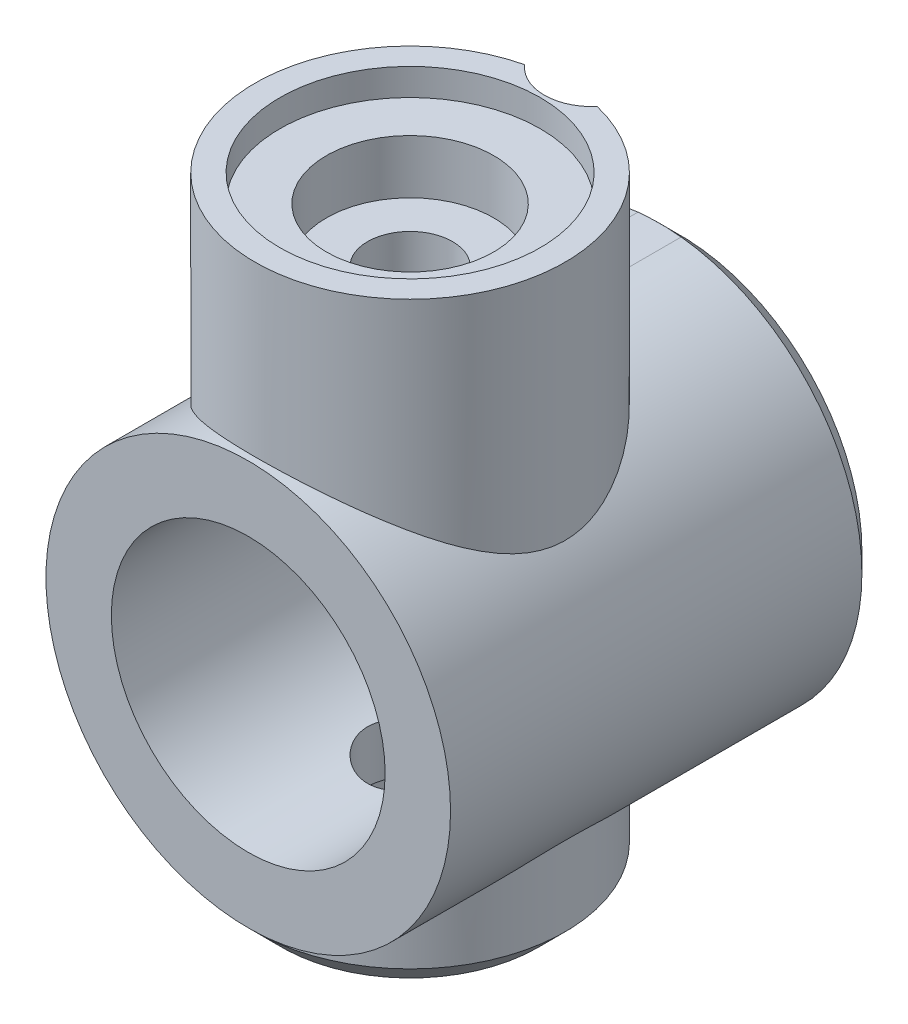
from build123d import *

# Parameters (mm, degrees)
EXTRUDE_1_DEPTH      = 45
SKETCH_5_R           = 7.9
EXTRUDE_3_DEPTH      = 45
CHAMFER_5_SIZE       = 8
CHAMFER_6_SIZE       = 2
FILLET_5_R           = 3
FILLET_6_R           = 2
SKETCH_7_R           = 15
SKETCH_7_R_2         = 10.15
EXTRUDE_4_DEPTH      = 45
SKETCH_6_R           = 1.6
SKETCH_6_R_2         = 3.1
CUT_EXTRUDE_4_DEPTH  = 85.113019206
SKETCH_10_R          = 11.5
EXTRUDE_5_DEPTH      = 50
FILLET_9_R           = 5
CUT_EXTRUDE_START    = -40
SKETCH_11_R          = 10.15
SKETCH_11_R_2        = 7.9
CUT_EXTRUDE_6_DEPTH  = 40
SKETCH_12_R          = 3.15
CUT_EXTRUDE_7_DEPTH  = 40
CHAMFER_9_SIZE       = 1.5
SKETCH_13_R          = 6.2
CUT_EXTRUDE_8_DEPTH  = 6
SKETCH_19_R          = 36.592880448
CUT_EXTRUDE_12_DEPTH = 87.890736042
SKETCH_20_R          = 20
CUT_EXTRUDE_13_DEPTH = 13
SKETCH_21_R          = 7.9
CUT_EXTRUDE_14_DEPTH = 74.008561269
SKETCH_22_W          = 4.064984698
SKETCH_22_H          = 0.276677518
SKETCH_22_W_2        = 3.2
SKETCH_22_H_2        = 0.1711549
CUT_EXTRUDE_15_DEPTH = 8.5
SKETCH_15_R          = 11.5
CUT_EXTRUDE_16_DEPTH = 5
SKETCH_23_R          = 5.2
CUT_EXTRUDE_17_DEPTH = 4
CHAMFER_10_SIZE      = 2
SKETCH_24_R          = 3.15
CUT_EXTRUDE_18_DEPTH = 74.159073316
SKETCH_25_R          = 9.65
CUT_EXTRUDE_19_DEPTH = 2
SKETCH_26_R          = 3.55
CUT_EXTRUDE_20_DEPTH = 14
SKETCH_27_R          = 3.55
CUT_EXTRUDE_21_DEPTH = 5


with BuildPart() as part:
    # 草图1 → 凸台-拉伸1 (new body)
    with BuildSketch(Plane(origin=(0, 0, 0), x_dir=(1, 0, 0), z_dir=(0, 1, 0))):
        with BuildLine():
            Line((0, 0), (55, 0))
            Line((55, 0), (55, -7))
            ThreePointArc((55, -7), (27.5, -34.5), (0, -7))
            Line((0, -7), (0, 0))
        make_face()
    extrude(amount=EXTRUDE_1_DEPTH)

    # 草图5 → 凸台-拉伸3 (add)
    with BuildSketch(Plane(origin=(0, 0, 0), x_dir=(-1, 0, 0), z_dir=(0, 0, -1))):
        with Locations((-27.5, 22.5)):
            Circle(SKETCH_5_R)
    extrude(amount=EXTRUDE_3_DEPTH)

    # 倒角5
    chamfer_5_edges = [part.edges().sort_by_distance(p)[0] for p in [
        (0, 45, 3.5),
        (55, 45, 3.5),
        (27.5, 45, 34.5),
        (0, 0, 3.5),
        (55, 0, 3.5),
        (27.5, 0, 34.5),
    ]]
    chamfer(chamfer_5_edges, length=CHAMFER_5_SIZE)

    # 倒角6
    chamfer_6_edges = [part.edges().sort_by_distance(p)[0] for p in [
        (4, 4, 0),
        (27.5, 0, 0),
        (51, 4, 0),
        (55, 22.5, 0),
        (51, 41, 0),
        (27.5, 45, 0),
        (4, 41, 0),
        (0, 22.5, 0),
    ]]
    chamfer(chamfer_6_edges, length=CHAMFER_6_SIZE)

    # 圆角5
    fillet_5_edges = [part.edges().sort_by_distance(p)[0] for p in [
        (35.4, 22.5, -45),
    ]]
    fillet(fillet_5_edges, radius=FILLET_5_R)

    # 圆角6
    fillet_6_edges = [part.edges().sort_by_distance(p)[0] for p in [
        (35.4, 22.5, 0),
    ]]
    fillet(fillet_6_edges, radius=FILLET_6_R)

    # 草图7 → 凸台-拉伸4 (add)
    with BuildSketch(Plane(origin=(0, 0, 0), x_dir=(-1, 0, 0), z_dir=(0, 0, -1))):
        with Locations((-27.5, 22.5)):
            Circle(SKETCH_7_R)
        with Locations((-27.5, 22.5)):
            Circle(SKETCH_7_R_2, mode=Mode.SUBTRACT)
    extrude(amount=EXTRUDE_4_DEPTH)

    # 草图6 → 切除-拉伸4 (cut, through all)
    with BuildSketch(Plane(origin=(0, 0, 0), x_dir=(1, 0, 0), z_dir=(0, 1, 0))):
        with Locations((27.5, 8.5)):
            Circle(SKETCH_6_R)
        with Locations((27.5, 25)):
            Circle(SKETCH_6_R_2)
        with Locations((27.5, 38.5)):
            Circle(SKETCH_6_R)
    extrude(amount=CUT_EXTRUDE_4_DEPTH, mode=Mode.SUBTRACT)

    # 草图10 → 凸台-拉伸5 (add)
    with BuildSketch(Plane(origin=(0, 0, 0), x_dir=(1, 0, 0), z_dir=(0, 1, 0))):
        with Locations((27.5, 25)):
            Circle(SKETCH_10_R)
    extrude(amount=EXTRUDE_5_DEPTH)

    # 圆角9
    fillet_9_edges = [part.edges().sort_by_distance(p)[0] for p in [
        (42.5, 22.5, 0),
    ]]
    fillet(fillet_9_edges, radius=FILLET_9_R)

    # 草图11 → 切除-拉伸6 (cut)
    with BuildSketch(Plane(origin=(0, 0, -45), x_dir=(-1, 0, 0), z_dir=(0, 0, -1)).offset(CUT_EXTRUDE_START)):
        with Locations((-27.5, 22.5)):
            Circle(SKETCH_11_R)
        with Locations((-27.5, 22.5)):
            Circle(SKETCH_11_R_2, mode=Mode.SUBTRACT)
    extrude(amount=CUT_EXTRUDE_6_DEPTH, mode=Mode.SUBTRACT)

    # 草图12 → 切除-拉伸7 (cut)
    with BuildSketch(Plane.XZ):
        with Locations((27.5, -25)):
            Circle(SKETCH_12_R)
    extrude(amount=-CUT_EXTRUDE_7_DEPTH, mode=Mode.SUBTRACT)

    # 倒角9
    chamfer_9_edges = [part.edges().sort_by_distance(p)[0] for p in [
        (37.65, 22.5, -45),
        (42.5, 22.5, -45),
    ]]
    chamfer(chamfer_9_edges, length=CHAMFER_9_SIZE)

    # 草图13 → 切除-拉伸8 (cut)
    with BuildSketch(Plane(origin=(0, 50, 0), x_dir=(1, 0, 0), z_dir=(0, 1, 0))):
        with Locations((27.5, 25)):
            Circle(SKETCH_13_R)
    extrude(amount=-CUT_EXTRUDE_8_DEPTH, mode=Mode.SUBTRACT)

    # 草图19 → 切除-拉伸12 (cut, through all)
    with BuildSketch(Plane(origin=(0, 0, 0), x_dir=(-1, 0, 0), z_dir=(0, 0, -1))):
        with Locations((-27.5, 22.5)):
            Circle(SKETCH_19_R)
    extrude(amount=-CUT_EXTRUDE_12_DEPTH, mode=Mode.SUBTRACT)


with BuildPart() as cut_extrude_12_piece_1:
    # of the separate pieces the step leaves, piece 1, a body of its own (cut_extrude_12_pieces)
    add(part.part.solids().sort_by_distance((12.5, 22.5, -43.5))[0])


with BuildPart() as cut_extrude_12_piece_2:
    # of the separate pieces the step leaves, piece 2, a body of its own (cut_extrude_12_pieces)
    add(part.part.solids().sort_by_distance((19.6, 22.5, -2))[0])


with BuildPart() as cut_extrude_13_tool:
    # 草图20 → 切除-拉伸13 (new body)
    with BuildSketch(Plane.XY):
        with Locations((27.5, 22.5)):
            Circle(SKETCH_20_R)
    extrude(amount=-CUT_EXTRUDE_13_DEPTH)


with BuildPart() as cut_extrude_12_piece_1_1:
    add(cut_extrude_12_piece_1.part)

    # 切除-拉伸13: cut by cut_extrude_13_tool
    add(cut_extrude_13_tool.part, mode=Mode.SUBTRACT)

    # 草图22 → 切除-拉伸15 (cut)
    with BuildSketch(Plane(origin=(0, 0, -45), x_dir=(-1, 0, 0), z_dir=(0, 0, -1))):
        with Locations((-27.5, 7.5)):
            Rectangle(SKETCH_22_W, SKETCH_22_H)
        with Locations((-27.5, 37.5)):
            Rectangle(SKETCH_22_W_2, SKETCH_22_H_2)
    extrude(amount=-CUT_EXTRUDE_15_DEPTH, mode=Mode.SUBTRACT)

    # 草图15 → 切除-拉伸16 (cut)
    with BuildSketch(Plane.XZ):
        with Locations((27.5, -25)):
            Circle(SKETCH_15_R)
    extrude(amount=-CUT_EXTRUDE_16_DEPTH, mode=Mode.SUBTRACT)

    # 草图23 → 切除-拉伸17 (cut)
    with BuildSketch(Plane.XZ.offset(-5)):
        with Locations((27.5, -25)):
            Circle(SKETCH_23_R)
    extrude(amount=-CUT_EXTRUDE_17_DEPTH, mode=Mode.SUBTRACT)

    # 倒角10
    chamfer_10_edges = [cut_extrude_12_piece_1_1.edges().sort_by_distance(p)[0] for p in [
        (16, 5, -25),
    ]]
    chamfer(chamfer_10_edges, length=CHAMFER_10_SIZE)

    # 草图24 → 切除-拉伸18 (cut, through all)
    with BuildSketch(Plane(origin=(0, 44, 0), x_dir=(1, 0, 0), z_dir=(0, 1, 0))):
        with Locations((27.5, 25)):
            Circle(SKETCH_24_R)
    extrude(amount=-CUT_EXTRUDE_18_DEPTH, mode=Mode.SUBTRACT)

    # 草图25 → 切除-拉伸19 (cut)
    with BuildSketch(Plane(origin=(0, 50, 0), x_dir=(1, 0, 0), z_dir=(0, 1, 0))):
        with Locations((27.5, 25)):
            Circle(SKETCH_25_R)
    extrude(amount=-CUT_EXTRUDE_19_DEPTH, mode=Mode.SUBTRACT)

    # 草图26 → 切除-拉伸20 (cut)
    with BuildSketch(Plane(origin=(0, 37.41442255, 0), x_dir=(1, 0, 0), z_dir=(0, 1, 0))):
        with Locations((27.5, 38.5)):
            Circle(SKETCH_26_R)
    extrude(amount=CUT_EXTRUDE_20_DEPTH, mode=Mode.SUBTRACT)

    # 草图27 → 切除-拉伸21 (cut)
    with BuildSketch(Plane.XZ.offset(-7.638338759)):
        with Locations((27.5, -38.5)):
            Circle(SKETCH_27_R)
    extrude(amount=CUT_EXTRUDE_21_DEPTH, mode=Mode.SUBTRACT)


with BuildPart() as cut_extrude_12_piece_2_1:
    add(cut_extrude_12_piece_2.part)

    # 切除-拉伸13: cut by cut_extrude_13_tool
    add(cut_extrude_13_tool.part, mode=Mode.SUBTRACT)

    # 草图21 → 切除-拉伸14 (cut, through all)
    with BuildSketch(Plane.XY.offset(-13)):
        with Locations((27.5, 22.5)):
            Circle(SKETCH_21_R)
    extrude(amount=-CUT_EXTRUDE_14_DEPTH, mode=Mode.SUBTRACT)


solid = cut_extrude_12_piece_1_1.part
